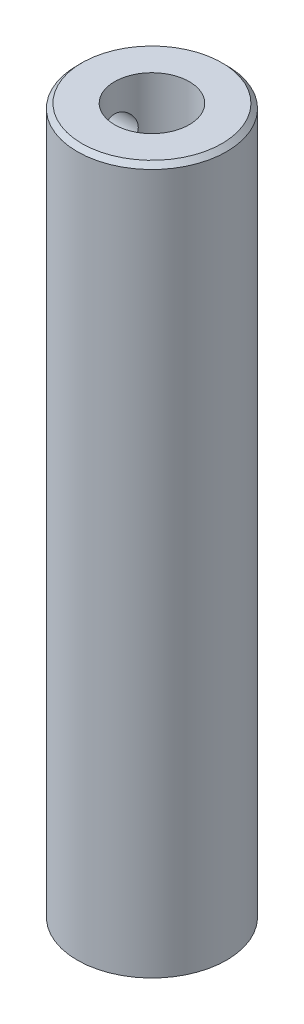
from build123d import *

# Parameters (mm, degrees)
SKETCH_1_R          = 8
EXTRUDE_1_DEPTH     = 75.5
CHAMFER_1_SIZE      = 0.5
SKETCH_3_R          = 4
CUT_EXTRUDE_1_DEPTH = 23
SKETCH_4_R          = 2
CUT_EXTRUDE_2_DEPTH = 23


with BuildPart() as part:
    # 스케치1 → 보스-돌출1 (new body)
    with BuildSketch(Plane(origin=(0, 0, 0), x_dir=(1, 0, 0), z_dir=(0, 1, 0))):
        Circle(SKETCH_1_R)
    extrude(amount=-EXTRUDE_1_DEPTH)

    # 모따기1
    chamfer_1_edges = [part.edges().sort_by_distance(p)[0] for p in [
        (-8, 0, 0),
    ]]
    chamfer(chamfer_1_edges, length=CHAMFER_1_SIZE)

    # 스케치3 → 컷-돌출1 (cut)
    with BuildSketch(Plane(origin=(0, 0, 0), x_dir=(1, 0, 0), z_dir=(0, 1, 0))):
        Circle(SKETCH_3_R)
    extrude(amount=-CUT_EXTRUDE_1_DEPTH, mode=Mode.SUBTRACT)

    # 스케치4 → 컷-돌출2 (cut)
    with BuildSketch(Plane(origin=(0, 0, 0), x_dir=(0, 0, -1), z_dir=(1, 0, 0))):
        with Locations((0, -5)):
            Circle(SKETCH_4_R)
    extrude(amount=-CUT_EXTRUDE_2_DEPTH, mode=Mode.SUBTRACT)


solid = part.part
